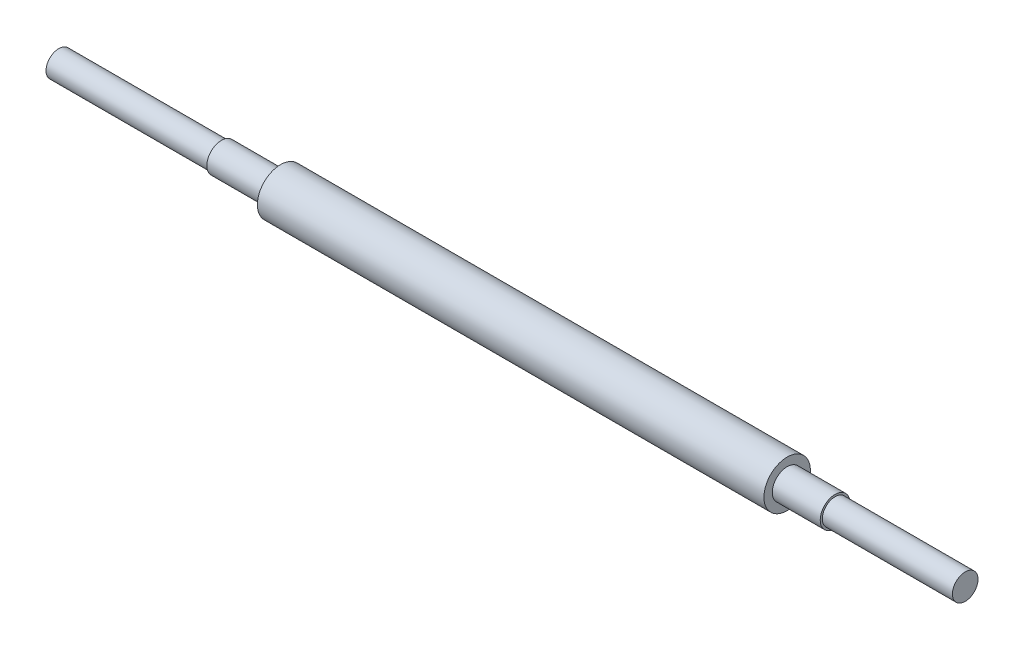
from build123d import *


with BuildPart() as part:
    # Sketch1 → Revolve1 (revolve)
    with BuildSketch(Plane(origin=(0, 0, 0), x_dir=(1, 0, 0), z_dir=(0, 1, 0))):
        Polygon((-78.63058905, 0), (-78.63058905, 3.499993), (-34.18058905, 3.499993), (-34.18058905, 4), (-18.01785785, 4), (-18.01785785, 6.35), (120.41214215, 6.35), (120.41214215, 4.064), (133.512142112, 4.064), (133.512142112, 3.499993), (169.072142112, 3.499993), (169.072142112, 0), align=None)
    revolve(axis=Axis((-97.950567047, 0, 0), (1, 0, 0)))


solid = part.part
